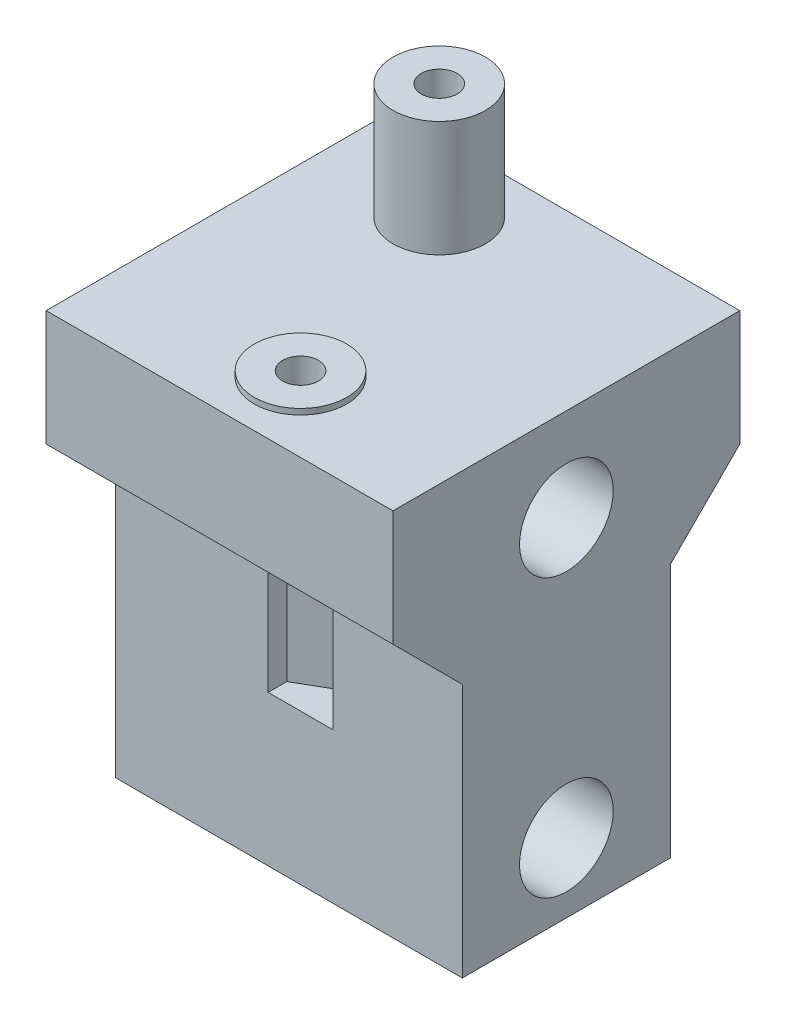
from build123d import *

# Parameters (mm, degrees)
SKETCH_1_W           = 30
SKETCH_1_H           = 30
EXTRUDE_1_DEPTH      = 38
SKETCH_3_R           = 4
EXTRUDE_3_DEPTH      = 10
SKETCH_7_R           = 4
EXTRUDE_4_DEPTH      = 0.5
SKETCH_6_R           = 4.05
CUT_EXTRUDE_3_DEPTH  = 65.062469512
SKETCH_9_R           = 1.55
CUT_EXTRUDE_4_DEPTH  = 51.833060109
CUT_EXTRUDE_6_DEPTH  = 65.062469512
CUT_EXTRUDE_5_DEPTH  = 15
SKETCH_12_W          = 4.9
SKETCH_12_H          = 15
EXTRUDE_5_DEPTH      = 7
SKETCH_14_W          = 0.3
SKETCH_14_H          = 13
CUT_EXTRUDE_7_DEPTH  = 5
SKETCH_15_R          = 1
CUT_EXTRUDE_8_DEPTH  = 62.365218161
CUT_EXTRUDE_10_DEPTH = 1.8


with BuildPart() as part:
    # 草图1 → 凸台-拉伸1 (new body)
    with BuildSketch(Plane(origin=(0, 0, 0), x_dir=(1, 0, 0), z_dir=(0, 1, 0))):
        with Locations((15, 15)):
            Rectangle(SKETCH_1_W, SKETCH_1_H)
    extrude(amount=EXTRUDE_1_DEPTH)

    # 草图3 → 凸台-拉伸3 (add)
    with BuildSketch(Plane(origin=(0, 38, -50), x_dir=(1, 0, 0), z_dir=(0, -1, 0))):
        with Locations((10, 26)):
            Circle(SKETCH_3_R)
    extrude(amount=-EXTRUDE_3_DEPTH)

    # 草图7 → 凸台-拉伸4 (add)
    with BuildSketch(Plane.XZ.offset(-38)):
        with Locations((16, -6)):
            Circle(SKETCH_7_R)
    extrude(amount=-EXTRUDE_4_DEPTH)

    # 草图6 → 切除-拉伸3 (cut, through all)
    with BuildSketch(Plane(origin=(30, 0, 0), x_dir=(0, 0, -1), z_dir=(1, 0, 0))):
        with Locations((15, 6)):
            Circle(SKETCH_6_R)
        with Locations((15, 30)):
            Circle(SKETCH_6_R)
    extrude(amount=-CUT_EXTRUDE_3_DEPTH, mode=Mode.SUBTRACT)

    # 草图9 → 切除-拉伸4 (cut, through all)
    with BuildSketch(Plane(origin=(0, 28, 0), x_dir=(1, 0, 0), z_dir=(0, 1, 0))):
        with Locations((16, 6)):
            Circle(SKETCH_9_R)
        with Locations((10, 24)):
            Circle(SKETCH_9_R)
    extrude(amount=CUT_EXTRUDE_4_DEPTH, mode=Mode.SUBTRACT)

    # 草图11 → 切除-拉伸6 (cut, through all)
    with BuildSketch(Plane(origin=(30, 0, 0), x_dir=(0, 0, -1), z_dir=(1, 0, 0))):
        Polygon((6, 0), (6, 22), (0, 28), (0, 0), align=None)
        Polygon((24, 0), (24, 22), (30, 28), (30, 0), align=None)
    extrude(amount=-CUT_EXTRUDE_6_DEPTH, mode=Mode.SUBTRACT)

    # 草图10 → 切除-拉伸5 (cut)
    with BuildSketch(Plane(origin=(0, 28, 0), x_dir=(1, 0, 0), z_dir=(0, 1, 0))):
        Polygon((18.8, 0), (18.8, 7.616580754), (16, 9.233161507), (13.2, 7.616580754), (13.2, 0), align=None)
        Polygon((10, 20.766838493), (12.8, 22.383419246), (12.8, 30), (7.2, 30), (7.2, 22.383419246), align=None)
    extrude(amount=-CUT_EXTRUDE_5_DEPTH, mode=Mode.SUBTRACT)

    # 草图12 → 凸台-拉伸5 (add)
    with BuildSketch(Plane.ZY):
        with Locations((-21.55, 7.5)):
            Rectangle(SKETCH_12_W, SKETCH_12_H)
    extrude(amount=EXTRUDE_5_DEPTH)

    # 草图14 → 切除-拉伸7 (cut)
    with BuildSketch(Plane.ZY.offset(7)):
        with Locations((-23.85, 8.5)):
            Rectangle(SKETCH_14_W, SKETCH_14_H)
    extrude(amount=-CUT_EXTRUDE_7_DEPTH, mode=Mode.SUBTRACT)

    # 草图15 → 切除-拉伸8 (cut, through all)
    with BuildSketch(Plane(origin=(0, 0, -23.7), x_dir=(-1, 0, 0), z_dir=(0, 0, -1))):
        with Locations((4, 12)):
            Circle(SKETCH_15_R)
        with Locations((4, 5.5)):
            Circle(SKETCH_15_R)
    extrude(amount=-CUT_EXTRUDE_8_DEPTH, mode=Mode.SUBTRACT)

    # 草图17 → 切除-拉伸10 (cut)
    with BuildSketch(Plane.XY.offset(-19.1)):
        Polygon((-1.95, 10.816431948), (-1.95, 13.183568052), (-4, 14.367136104), (-6.05, 13.183568052), (-6.05, 10.816431948), (-4, 9.632863896), align=None)
        Polygon((-1.95, 4.316431948), (-1.95, 6.683568052), (-4, 7.867136104), (-6.05, 6.683568052), (-6.05, 4.316431948), (-4, 3.132863896), align=None)
    extrude(amount=-CUT_EXTRUDE_10_DEPTH, mode=Mode.SUBTRACT)


solid = part.part
